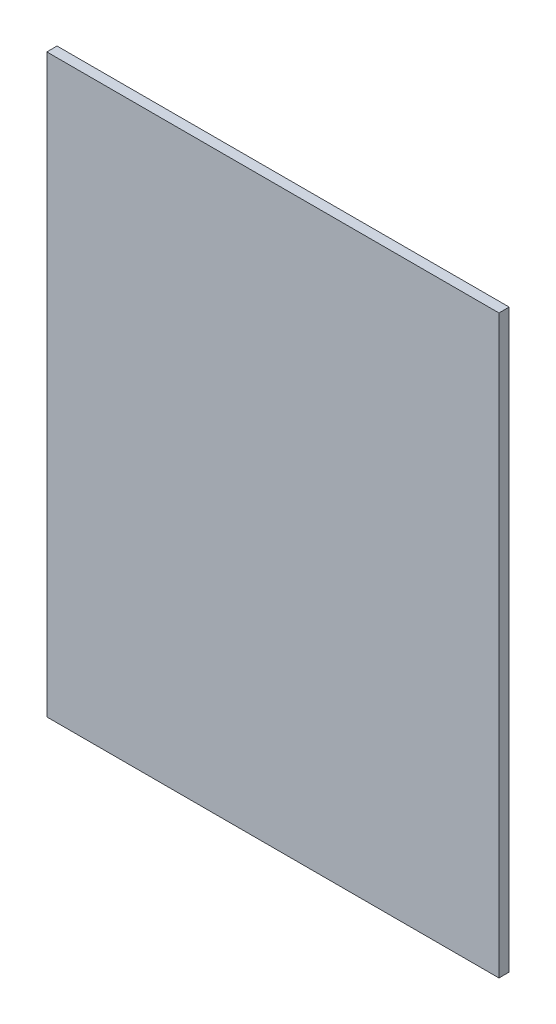
from build123d import *

# Parameters (mm, degrees)
SKETCH1_W          = 84
SKETCH1_H          = 107
BASE_FLANGE1_DEPTH = 1.89738


# Sheet-metal steps are written as plain solids
with BuildPart() as part:
    # Sketch1 → Base-Flange1 (new body)
    with BuildSketch(Plane.XY):
        with Locations((13.9192673, 11.510731857)):
            Rectangle(SKETCH1_W, SKETCH1_H)
    extrude(amount=-BASE_FLANGE1_DEPTH)


solid = part.part
